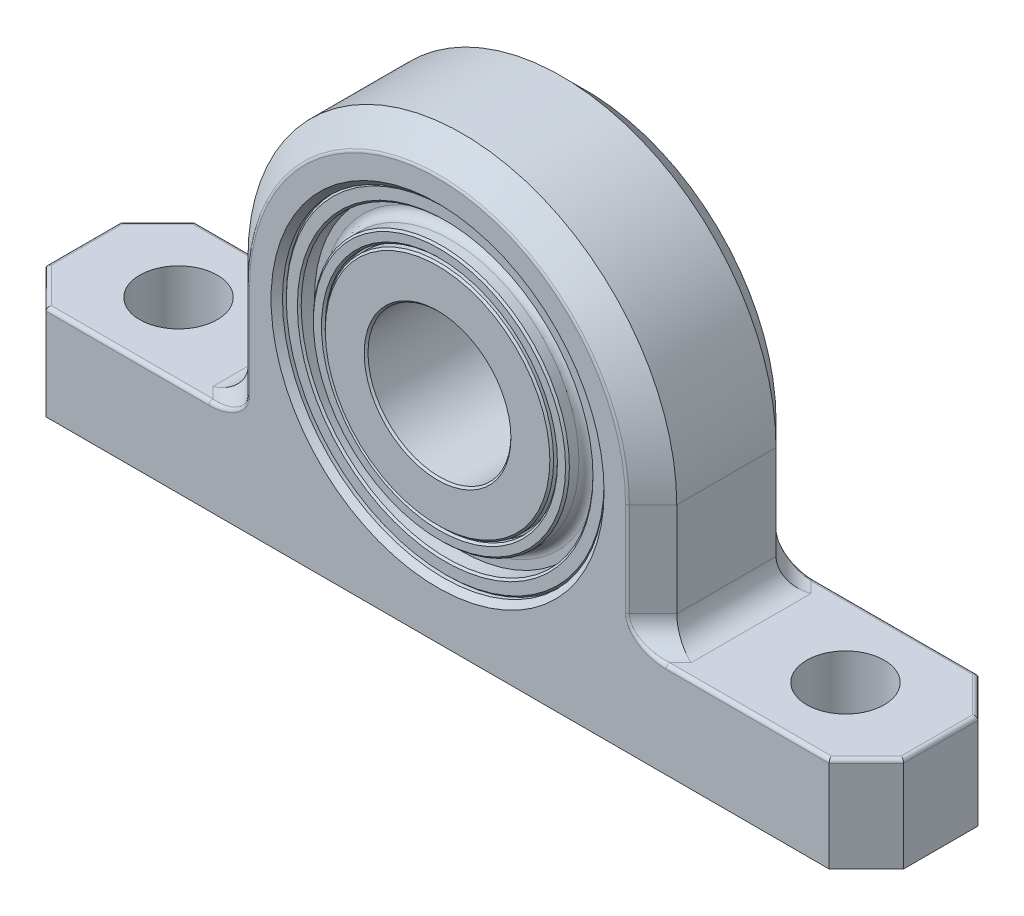
from build123d import *
from OCP.BRepAlgoAPI import BRepAlgoAPI_Cut
from OCP.TopTools import TopTools_ListOfShape

# Parameters (mm, degrees)
EXTRUDE1_DEPTH      = 4.960938
EXTRUDE1_DEPTH_BACK = 4.960938
SKETCH3_R           = 10.715625
SKETCH4_R           = 2.5796875
CUT_EXTRUDE1_DEPTH  = 37.538912899
CHAMFER3_SIZE       = 1.653645833
FILLET6_R           = 1.653645833
FILLET7_R           = 0.254
CHAMFER4_SIZE       = 0.381
CHAMFER5_SIZE       = 0.127
FILLET8_R           = 0.635


with BuildPart() as part:
    # Sketch3 → Extrude1 (new, two sides: drawn at the far end of the back side and taken through both)
    with BuildSketch(Plane.XY.offset(-EXTRUDE1_DEPTH_BACK)):
        with BuildLine():
            Line((14.2875, 0), (14.2875, -7.9375))
            Line((14.2875, -7.9375), (28.575, -7.9375))
            Line((28.575, -7.9375), (28.575, -14.2875))
            Line((28.575, -14.2875), (-28.575, -14.2875))
            Line((-28.575, -14.2875), (-28.575, -7.9375))
            Line((-28.575, -7.9375), (-14.2875, -7.9375))
            Line((-14.2875, -7.9375), (-14.2875, 0))
            ThreePointArc((-14.2875, 0), (0, 14.2875), (14.2875, 0))
        make_face()
        with Locations(Location((0, 0, 0), (0, 0, 180))):
            Circle(SKETCH3_R, mode=Mode.SUBTRACT)
    extrude(amount=EXTRUDE1_DEPTH + EXTRUDE1_DEPTH_BACK)


with BuildPart() as cut_extrude1_tool:
    # Sketch4 → Cut-Extrude1 (new, through all)
    with BuildSketch(Plane(origin=(0, -7.9375, 0), x_dir=(1, 0, 0), z_dir=(0, 1, 0))):
        with Locations(Location((-22.225, 0, 0), (0, 0, 270))):
            Circle(SKETCH4_R)
        with Locations(Location((22.225, 0, 0), (0, 0, 270))):
            Circle(SKETCH4_R)
        Polygon((-28.575, 4.9609375), (-28.575, 2.48046875), (-26.09453125, 4.9609375), align=None)
        Polygon((26.09453125, 4.9609375), (28.575, 4.9609375), (28.575, 2.48046875), align=None)
        Polygon((28.575, -4.9609375), (28.575, -2.48046875), (26.09453125, -4.9609375), align=None)
        Polygon((-26.09453125, -4.9609375), (-28.575, -4.9609375), (-28.575, -2.48046875), align=None)
    extrude(amount=-CUT_EXTRUDE1_DEPTH)


with BuildPart() as part_1:
    add(part.part)

    # Cut-Extrude1: cut by cut_extrude1_tool, with a tolerance
    cut_extrude1_stock = TopTools_ListOfShape()
    cut_extrude1_stock.Append(part_1.part.wrapped)
    cut_extrude1_tools = TopTools_ListOfShape()
    cut_extrude1_tools.Append(cut_extrude1_tool.part.wrapped)
    cut_extrude1_cut = BRepAlgoAPI_Cut()
    cut_extrude1_cut.SetArguments(cut_extrude1_stock)
    cut_extrude1_cut.SetTools(cut_extrude1_tools)
    cut_extrude1_cut.SetFuzzyValue(0.00001)
    cut_extrude1_cut.Build()
    add(Compound.cast(cut_extrude1_cut.Shape()).solids(), mode=Mode.REPLACE)

    # Chamfer3
    chamfer3_edges = [part_1.edges().sort_by_distance(p)[0] for p in [
        (0, 14.2875, -4.960938),
        (14.2875, -3.96875, -4.960938),
        (14.2875, -3.96875, 4.960938),
        (-14.2875, -3.96875, -4.960938),
        (0, 14.2875, 4.960938),
        (-14.2875, -3.96875, 4.960938),
    ]]
    chamfer(chamfer3_edges, length=CHAMFER3_SIZE)

    # Fillet6
    fillet6_edges = [part_1.edges().sort_by_distance(p)[0] for p in [
        (14.2875, -7.9375, 0),
        (-13.460677083, -7.9375, -4.134115083),
        (13.460677083, -7.9375, -4.134115083),
        (-13.460677083, -7.9375, 4.134115083),
        (13.460677083, -7.9375, 4.134115083),
        (-14.2875, -7.9375, 0),
    ]]
    fillet(fillet6_edges, radius=FILLET6_R)

    # Fillet7
    fillet7_edges = [part_1.edges().sort_by_distance(p)[0] for p in [
        (12.633854167, -3.141927083, -4.960938),
        (0, 12.633854167, -4.960938),
        (0, 12.633854167, 4.960938),
        (-12.633854167, -3.141927083, 4.960938),
        (-20.533496891, -7.9375, 4.960937707),
        (-20.533496891, -7.9375, -4.960937707),
        (-12.633854167, -3.141927083, -4.960938),
        (12.633854167, -3.141927083, 4.960938),
        (-13.461607153, -7.546075444, -4.960938),
        (-13.461607153, -7.546075444, 4.960938),
        (13.461607153, -7.546075444, -4.960938),
        (13.461607153, -7.546075444, 4.960938),
        (-27.334765625, -7.9375, -3.720703125),
        (20.533496891, -7.9375, -4.960937707),
        (27.334765625, -7.9375, -3.720703125),
        (28.575, -7.9375, 0),
        (20.533496891, -7.9375, 4.960937707),
        (27.334765625, -7.9375, 3.720703125),
        (-28.575, -7.9375, 0),
        (-27.334765625, -7.9375, 3.720703125),
    ]]
    fillet(fillet7_edges, radius=FILLET7_R)

    # Chamfer4
    chamfer4_edges = [part_1.edges().sort_by_distance(p)[0] for p in [
        (10.715625, 0, 4.960938),
        (10.715625, 0, -4.960938),
    ]]
    chamfer(chamfer4_edges, length=CHAMFER4_SIZE)


with BuildPart() as body_2:
    # Sketch5 → Revolve1 (revolve)
    with BuildSketch(Plane(origin=(0, 0, 0), x_dir=(0, 0, -1), z_dir=(1, 0, 0)), mode=Mode.PRIVATE) as revolve1_sk:
        Polygon((-4.4529375, 9.7234375), (-3.4369375, 9.7234375), (-3.4369375, 8.5328125), (-4.8339375, 8.5328125), (-4.8339375, 7.7390625), (-4.3259375, 7.7390625), (-4.3259375, 7.6120625), (-4.9609375, 7.6120625), (-4.9609375, 4.7625), (4.9609375, 4.7625), (4.9609375, 7.6120625), (4.3259375, 7.6120625), (4.3259375, 7.7390625), (4.8339375, 7.7390625), (4.8339375, 8.5328125), (3.4369375, 8.5328125), (3.4369375, 9.7234375), (4.4529375, 9.7234375), (4.4529375, 10.715625), (-4.4529375, 10.715625), align=None)
    revolve(revolve1_sk.sketch.rotate(Axis((0, 0, -4.9609375), (0, 0, 1)), 90), axis=Axis((0, 0, -4.9609375), (0, 0, 1)))

    # Chamfer5
    chamfer5_edges = [body_2.edges().sort_by_distance(p)[0] for p in [
        (8.5328125, 0, 4.8339375),
        (7.7390625, 0, 4.8339375),
        (7.6120625, 0, 4.9609375),
        (4.7625, 0, 4.9609375),
        (4.7625, 0, -4.9609375),
        (7.6120625, 0, -4.9609375),
        (7.7390625, 0, -4.8339375),
        (8.5328125, 0, -4.8339375),
        (9.7234375, 0, -4.4529375),
        (10.715625, 0, -4.4529375),
        (10.715625, 0, 4.4529375),
        (9.7234375, 0, 4.4529375),
    ]]
    chamfer(chamfer5_edges, length=CHAMFER5_SIZE)

    # Fillet8
    fillet8_edges = [body_2.edges().sort_by_distance(p)[0] for p in [
        (8.5328125, 0, 3.4369375),
        (8.5328125, 0, -3.4369375),
    ]]
    fillet(fillet8_edges, radius=FILLET8_R)


solid = Compound([part_1.part, body_2.part])
